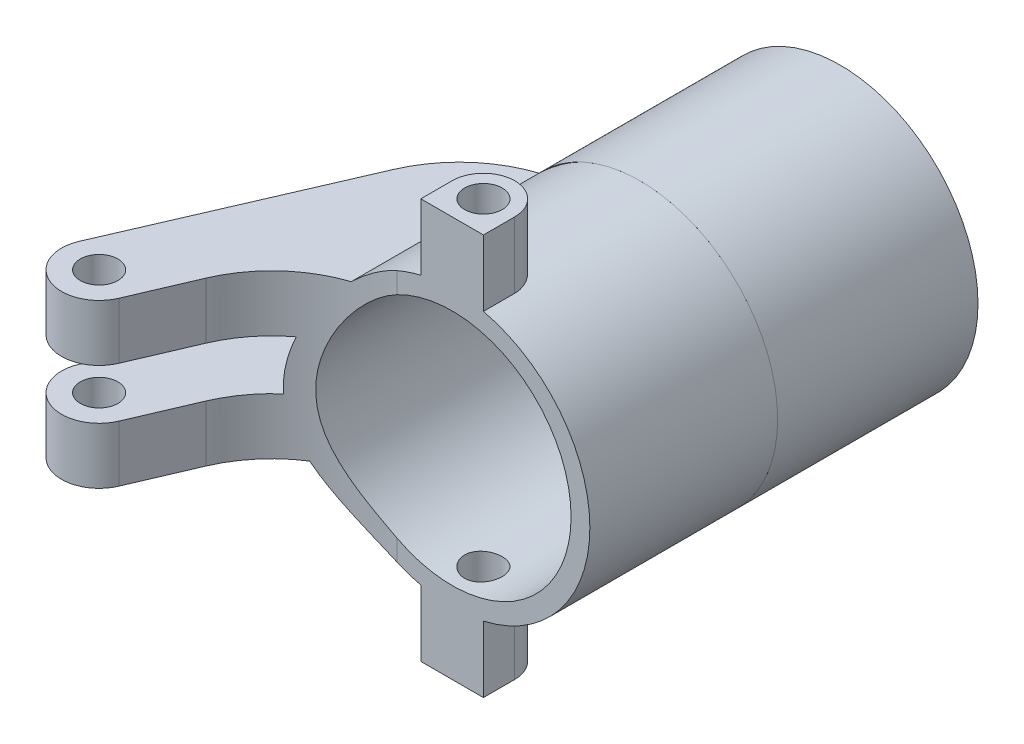
from build123d import *

# Parameters (mm, degrees)
CROQUIS1_R                   = 11
CROQUIS1_R_2                 = 9.5
SALIENTE_EXTRUIR1_DEPTH      = 15
SALIENTE_EXTRUIR2_REACH      = 34.787
SALIENTE_EXTRUIR2_END_RADIUS = 11
CROQUIS2_W                   = 5
CROQUIS2_H                   = 5
SALIENTE_EXTRUIR3_REACH      = 39.014
SALIENTE_EXTRUIR3_END_RADIUS = 11
CROQUIS3_W                   = 5
CROQUIS3_H                   = 5
CORTAR_EXTRUIR1_REACH        = 39.014
CROQUIS4_R                   = 1.5
REDONDEO1_R                  = 2.5
CROQUIS5_R                   = 1.5
SALIENTE_EXTRUIR4_DEPTH      = 4.5
SALIENTE_EXTRUIR5_REACH      = 40.863
CROQUIS6_W                   = 15
CROQUIS6_H                   = 4.5
CROQUIS7_R                   = 1.5
SALIENTE_EXTRUIR6_DEPTH      = 4.5
SALIENTE_EXTRUIR7_REACH      = 40.863
SALIENTE_EXTRUIR7_END_RADIUS = 11
CROQUIS8_W                   = 15
CROQUIS8_H                   = 4.5
REDONDEO4_R                  = 10
CROQUIS17_R                  = 9.5
SALIENTE_EXTRUIR13_DEPTH     = 16
REDONDEO5_R                  = 10


# Some blends are built 0.0001 mm under size
with BuildPart() as part:
    # Croquis1 → Saliente-Extruir1 (new body)
    with BuildSketch(Plane.XY):
        Circle(CROQUIS1_R)
        Circle(CROQUIS1_R_2, mode=Mode.SUBTRACT)
    extrude(amount=SALIENTE_EXTRUIR1_DEPTH)

    # Saliente-Extruir2: up to this cylinder (the profile starts outside it)
    saliente_extruir2_end = Plane(origin=(0, 0, 12.5), z_dir=(0, 0, -1)) * Cylinder(SALIENTE_EXTRUIR2_END_RADIUS, 92.574, mode=Mode.PRIVATE)
    # Croquis2 → Saliente-Extruir2 (add, up to the surface)
    with BuildSketch(Plane(origin=(0, 16, 0), x_dir=(1, 0, 0), z_dir=(0, 1, 0)), mode=Mode.PRIVATE) as saliente_extruir2_sk1:
        with Locations((0, -12.5)):
            Rectangle(CROQUIS2_W, CROQUIS2_H)
    saliente_extruir2_tool1 = extrude(saliente_extruir2_sk1.sketch, amount=-SALIENTE_EXTRUIR2_REACH, mode=Mode.PRIVATE) - saliente_extruir2_end
    add(saliente_extruir2_tool1.solids().sort_by_distance((0, 16, 12.5))[0])

    # Saliente-Extruir3: up to this cylinder (the profile starts outside it)
    saliente_extruir3_end = Plane(origin=(0, 0, 12.5), z_dir=(0, 0, -1)) * Cylinder(SALIENTE_EXTRUIR3_END_RADIUS, 101.028, mode=Mode.PRIVATE)
    # Croquis3 → Saliente-Extruir3 (add, up to the surface)
    with BuildSketch(Plane(origin=(0, -16, 0), x_dir=(1, 0, 0), z_dir=(0, 1, 0)), mode=Mode.PRIVATE) as saliente_extruir3_sk1:
        with Locations((0, -12.5)):
            Rectangle(CROQUIS3_W, CROQUIS3_H)
    saliente_extruir3_tool1 = extrude(saliente_extruir3_sk1.sketch, amount=SALIENTE_EXTRUIR3_REACH, mode=Mode.PRIVATE) - saliente_extruir3_end
    add(saliente_extruir3_tool1.solids().sort_by_distance((0, -16, 12.5))[0])

    # Cortar-Extruir1: up to this face of the body (flat: up to its plane)
    cortar_extruir1_end = Plane(part.part.faces().sort_by_distance((0, -16, 12.5))[0])
    # Croquis4 → Cortar-Extruir1 (cut, up to the picked face)
    with BuildSketch(Plane(origin=(0, 16, 0), x_dir=(1, 0, 0), z_dir=(0, 1, 0)), mode=Mode.PRIVATE) as cortar_extruir1_sk1:
        with Locations(Location((0, -12.5, 0), (0, 0, 270))):
            Circle(CROQUIS4_R)
    cortar_extruir1_tool1 = split(extrude(cortar_extruir1_sk1.sketch, amount=-CORTAR_EXTRUIR1_REACH, mode=Mode.PRIVATE), bisect_by=cortar_extruir1_end, keep=Keep.BOTH, mode=Mode.PRIVATE)
    add(cortar_extruir1_tool1.solids().sort_by(Axis((0, 16, 12.5), (0, -1, 0)))[0], mode=Mode.SUBTRACT)

    # Redondeo1
    redondeo1_edges = [part.edges().sort_by_distance(p)[0] for p in [
        (-2.5, -13.356071321, 10),
        (2.5, -13.356071321, 10),
        (-2.5, 13.356071321, 10),
        (2.5, 13.356071321, 10),
    ]]
    fillet(redondeo1_edges, radius=REDONDEO1_R - 0.0001)  # a hair under: the kernel refuses the full size

    # Croquis6 → Saliente-Extruir5 (add, up to next)
    with BuildSketch(Plane(origin=(-11, 0, 0), x_dir=(0, 0, -1), z_dir=(1, 0, 0)), mode=Mode.PRIVATE) as saliente_extruir5_sk1:
        with Locations((-7.5, -2.75)):
            Rectangle(CROQUIS6_W, CROQUIS6_H)
    saliente_extruir5_tool1 = extrude(saliente_extruir5_sk1.sketch, amount=SALIENTE_EXTRUIR5_REACH, mode=Mode.PRIVATE) - part.part


with BuildPart() as body_2:
    # Croquis5 → Saliente-Extruir4 (new body)
    with BuildSketch(Plane(origin=(0, -5, 0), x_dir=(1, 0, 0), z_dir=(0, 1, 0))):
        with BuildLine():
            Line((-11, -15), (-15.680701356, -25.935492506))
            ThreePointArc((-15.680701356, -25.935492506), (-19.62440656, -27.510730169), (-21.192151754, -23.564040489))
            Line((-21.192151754, -23.564040489), (-11, 0))
            Line((-11, 0), (-11, -15))
        make_face()
        with Locations(Location((-18.438678413, -24.755, 0), (0, 0, 270))):
            Circle(CROQUIS5_R, mode=Mode.SUBTRACT)
    extrude(amount=SALIENTE_EXTRUIR4_DEPTH)


with BuildPart() as part_1:
    add(part.part)

    add(body_2.part)  # Saliente-Extruir5 merges body 2
    add(saliente_extruir5_tool1.solids().sort_by_distance((-11, -2.75, 7.5))[0])



with BuildPart() as body_2_2:
    # Croquis7 → Saliente-Extruir6 (new body)
    with BuildSketch(Plane(origin=(0, 8, 0), x_dir=(1, 0, 0), z_dir=(0, 1, 0))):
        with BuildLine():
            Line((-15.680701356, -25.935492506), (-11, -15))
            Line((-11, -15), (-11, 0))
            Line((-11, 0), (-21.192151754, -23.564040489))
            ThreePointArc((-21.192151754, -23.564040489), (-19.62440656, -27.510730169), (-15.680701356, -25.935492506))
        make_face()
        with Locations(Location((-18.438678413, -24.755, 0), (0, 0, 270))):
            Circle(CROQUIS7_R, mode=Mode.SUBTRACT)
    extrude(amount=-SALIENTE_EXTRUIR6_DEPTH)


with BuildPart() as part_2:
    add(part_1.part)

    add(body_2_2.part)  # Saliente-Extruir7 merges body 2 2
    # Saliente-Extruir7: up to this cylinder (the profile starts outside it)
    saliente_extruir7_end = Plane(origin=(0, 0, 7.5), z_dir=(0, 0, -1)) * Cylinder(SALIENTE_EXTRUIR7_END_RADIUS, 104.726, mode=Mode.PRIVATE)
    # Croquis8 → Saliente-Extruir7 (add, up to the surface)
    with BuildSketch(Plane(origin=(-11, 0, 0), x_dir=(0, 0, -1), z_dir=(1, 0, 0)), mode=Mode.PRIVATE) as saliente_extruir7_sk1:
        with Locations((-7.5, 5.75)):
            Rectangle(CROQUIS8_W, CROQUIS8_H)
    saliente_extruir7_tool1 = extrude(saliente_extruir7_sk1.sketch, amount=SALIENTE_EXTRUIR7_REACH, mode=Mode.PRIVATE) - saliente_extruir7_end
    add(saliente_extruir7_tool1.solids().sort_by_distance((-11, 5.75, 7.5))[0])

    # Redondeo4
    # the kernel refuses this fillet: 10 mm, written as the material it adds along each edge
    with BuildSketch(Plane(origin=(-11, 8, 15), x_dir=(1, 0, 0), z_dir=(0, -1, 0))) as redondeo4_piece_1_section:
        with BuildLine():
            CenterArc((REDONDEO4_R * 0.659725391862, REDONDEO4_R), REDONDEO4_R, 203.1723, 66.8277)
            Line((-REDONDEO4_R * 0.259600293631, REDONDEO4_R * 0.606502498111), (0, 0))
            Line((0, 0), (REDONDEO4_R * 0.659725391862, 0))
        make_face()
    redondeo4_piece_1 = extrude(amount=4.5, mode=Mode.PRIVATE)
    redondeo4_piece_1 = redondeo4_piece_1 - Plane(origin=(0, 0, 16.61768541), x_dir=(1, 0, 0), z_dir=(0, 0, -1)) * Cylinder(9.5, 36, mode=Mode.PRIVATE)
    add(redondeo4_piece_1)
    with BuildSketch(Plane(origin=(-11, 24.493134797, 15), x_dir=(1, 0, 0), z_dir=(0, -1, 0))) as redondeo4_piece_2_section:
        with BuildLine():
            CenterArc((REDONDEO4_R * 0.659725391862, REDONDEO4_R), REDONDEO4_R, 203.1723, 66.8277)
            Line((-REDONDEO4_R * 0.259600293631, REDONDEO4_R * 0.606502498111), (0, 0))
            Line((0, 0), (REDONDEO4_R * 0.659725391862, 0))
        make_face()
    redondeo4_piece_2 = extrude(amount=37.486269593, mode=Mode.PRIVATE)
    redondeo4_piece_2 = redondeo4_piece_2 & Plane(origin=(0, 0, 15.105091538), x_dir=(1, 0, 0), z_dir=(0, 0, -1)) * Cylinder(11, 102, mode=Mode.PRIVATE)
    redondeo4_piece_2 = redondeo4_piece_2 - Plane(origin=(0, 0, 15.105091538), x_dir=(1, 0, 0), z_dir=(0, 0, -1)) * Cylinder(9.5, 102, mode=Mode.PRIVATE)
    add(redondeo4_piece_2)
    with BuildSketch(Plane(origin=(-11, 24.493134797, 15), x_dir=(1, 0, 0), z_dir=(0, -1, 0))) as redondeo4_piece_3_section:
        with BuildLine():
            CenterArc((REDONDEO4_R * 0.659725391862, REDONDEO4_R), REDONDEO4_R, 203.1723, 66.8277)
            Line((-REDONDEO4_R * 0.259600293631, REDONDEO4_R * 0.606502498111), (0, 0))
            Line((0, 0), (REDONDEO4_R * 0.659725391862, 0))
        make_face()
    redondeo4_piece_3 = extrude(amount=37.486269593, mode=Mode.PRIVATE)
    redondeo4_piece_3 = split(redondeo4_piece_3, bisect_by=Plane(origin=(-11.425826718, -5, 17.078004586), z_dir=(0, 1, 0)), keep=Keep.TOP, mode=Mode.PRIVATE)
    redondeo4_piece_3 = split(redondeo4_piece_3, bisect_by=Plane(origin=(-11.425826718, -0.5, 17.078004586), z_dir=(0, -1, 0)), keep=Keep.TOP, mode=Mode.PRIVATE)
    redondeo4_piece_3 = redondeo4_piece_3 - Plane(origin=(0, 0, 17.078004586), x_dir=(1, 0, 0), z_dir=(0, 0, -1)) * Cylinder(9.5, 102, mode=Mode.PRIVATE)
    add(redondeo4_piece_3)

    # Redondeo5
    # the kernel refuses this fillet: 10 mm, written as the material it takes off along each edge
    with BuildSketch(Plane(origin=(-11, -21.425077205, 0), x_dir=(1, 0, 0), z_dir=(0, 1, 0))) as redondeo5_piece_1:
        with BuildLine():
            CenterArc((REDONDEO5_R * 0.657003088186, -REDONDEO5_R), REDONDEO5_R, 90, 66.610075059)
            Line((-REDONDEO5_R * 0.260821358969, -REDONDEO5_R * 0.603013496194), (0, 0))
            Line((0, 0), (REDONDEO5_R * 0.657003088186, 0))
        make_face()
    extrude(amount=37.350154409, mode=Mode.SUBTRACT)


with BuildPart() as body_2_3:
    # Croquis17 → Saliente-Extruir13 (new body)
    with BuildSketch(Plane(origin=(0, 0, -16), x_dir=(-1, 0, 0), z_dir=(0, 0, -1))):
        with BuildLine():
            ThreePointArc((7.549834435, 8), (-10.839118231, -1.874437511), (9.797958971, -5))
            ThreePointArc((9.797958971, -5), (10.63405263, -2.813703017), (10.988630488, -0.5))
            ThreePointArc((10.988630488, -0.5), (10.893645622, 1.525937434), (10.428326807, 3.5))
            ThreePointArc((10.428326807, 3.5), (9.266394683, 5.927388091), (7.549834435, 8))
        make_face()
        Circle(CROQUIS17_R, mode=Mode.SUBTRACT)
    extrude(amount=-SALIENTE_EXTRUIR13_DEPTH)


solid = Compound([part_2.part, body_2_3.part])
